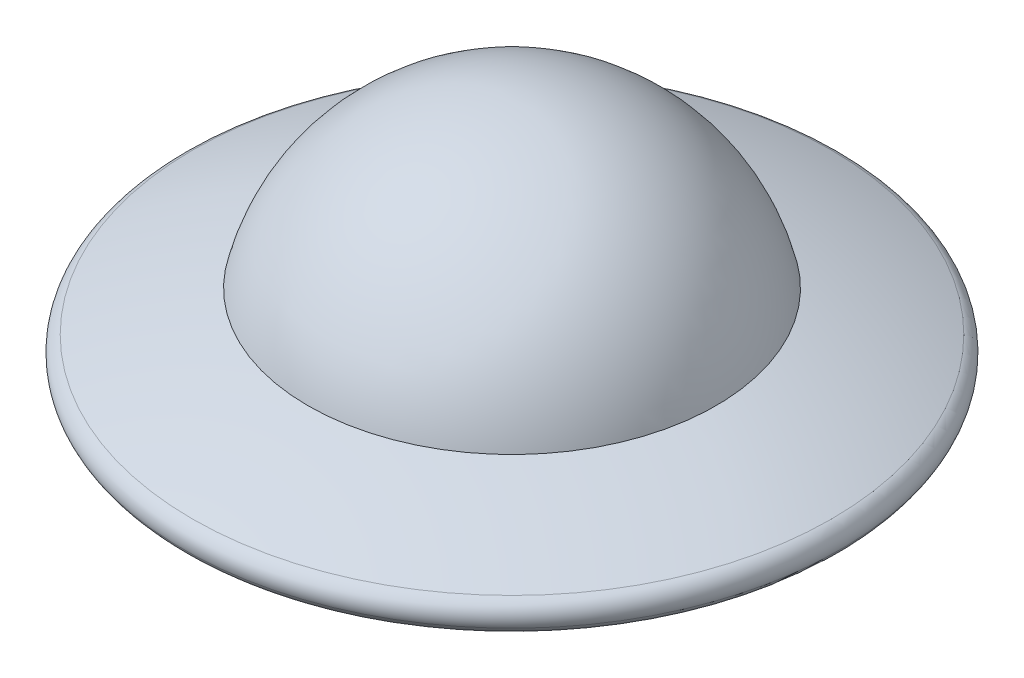
from build123d import *

# Parameters (mm, degrees)
FILLET1_R = 1


with BuildPart() as part:
    # Sketch2 → Revolve2 (revolve)
    with BuildSketch(Plane(origin=(0, 0, 0), x_dir=(0, 0, -1), z_dir=(1, 0, 0))):
        with BuildLine():
            Line((20, 43.084219849), (19.157894737, 41.270147434))
            ThreePointArc((19.157894737, 41.270147434), (14.87108075, 43.001173906), (10.430737971, 44.288256969))
            ThreePointArc((10.430737971, 44.288256969), (6.985972024, 50.92298218), (0, 53.584219849))
            Line((0, 53.584219849), (0, 55.584219849))
            ThreePointArc((0, 55.584219849), (7.774653566, 52.872210549), (12.175717887, 45.912981758))
            ThreePointArc((12.175717887, 45.912981758), (16.149912658, 44.67023977), (20, 43.084219849))
        make_face()
    revolve(axis=Axis((0, 55.584219849, 0), (0, -1, 0)))

    # Fillet1
    fillet1_edges = [part.edges().sort_by_distance(p)[0] for p in [
        (0, 43.084219849, 20),
        (0, 41.270147434, 19.157894737),
    ]]
    fillet(fillet1_edges, radius=FILLET1_R - 0.0001)  # a hair under: the kernel refuses the full size


solid = part.part
